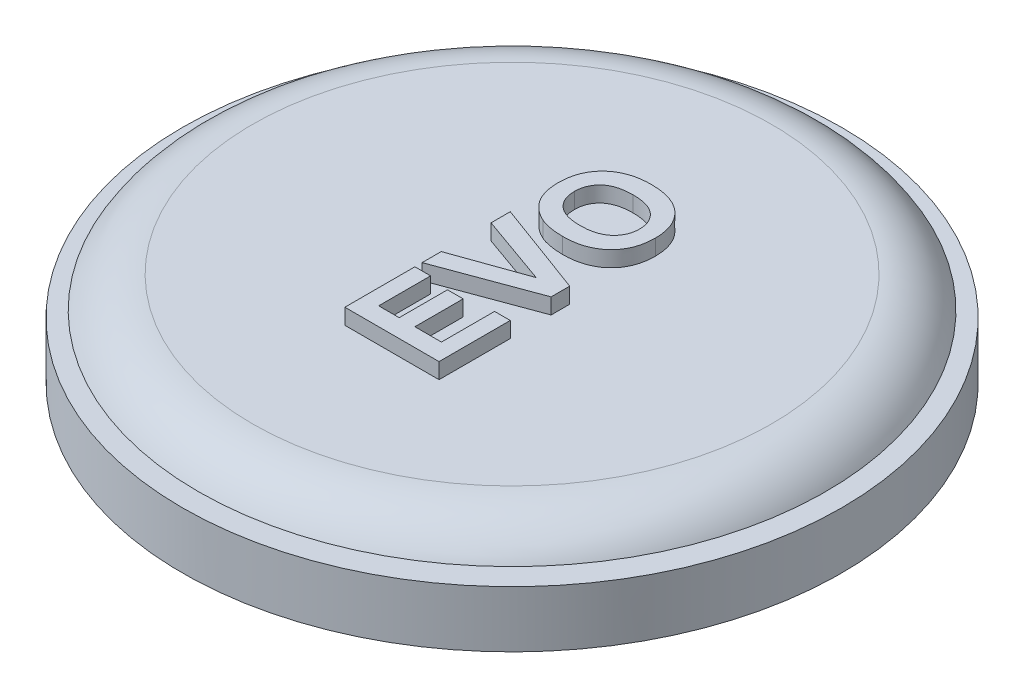
from build123d import *

# Parameters (mm, degrees)
SKETCH1_R           = 17.3
BOSS_EXTRUDE1_DEPTH = 4
SKETCH2_R           = 20
BOSS_EXTRUDE2_DEPTH = 2
CHAMFER1_SIZE       = 0.5
CHAMFER1_SIZE2      = 1.37373871
BOSS_EXTRUDE3_DEPTH = 1
SKETCH4_R           = 21
SKETCH4_R_2         = 17.8
BOSS_EXTRUDE4_DEPTH = 3.6
FILLET1_R           = 4


with BuildPart() as part:
    # Sketch1 → Boss-Extrude1 (new body)
    with BuildSketch(Plane(origin=(0, 0, 0), x_dir=(1, 0, 0), z_dir=(0, 1, 0))):
        with Locations(Location((0, 0, 0), (0, 0, 270))):
            Circle(SKETCH1_R)
    extrude(amount=BOSS_EXTRUDE1_DEPTH)

    # Sketch2 → Boss-Extrude2 (add)
    with BuildSketch(Plane(origin=(0, 4, 0), x_dir=(1, 0, 0), z_dir=(0, 1, 0))):
        with Locations(Location((0, 0, 0), (0, 0, 270))):
            Circle(SKETCH2_R)
    extrude(amount=BOSS_EXTRUDE2_DEPTH)

    # Chamfer1
    chamfer1_edges = [part.edges().sort_by_distance(p)[0] for p in [
        (0, 0, -17.3),
    ]]
    chamfer1_side = [part.faces().sort_by_distance(p)[0] for p in [
        (0, 0, 0),
    ]]
    chamfer(chamfer1_edges, length=CHAMFER1_SIZE, length2=CHAMFER1_SIZE2, reference=chamfer1_side[0])

    # Sketch3 → Boss-Extrude3 (add)
    # profile 1 of 3: a face of its own
    with BuildSketch(Plane(origin=(0, 6, 0), x_dir=(1, 0, 0), z_dir=(0, 1, 0))):
        Polygon((3.5, -8.153846154), (-2.5, -8.153846154), (-2.5, -3.692307692), (-1.5, -3.692307692), (-1.5, -7), (-0.192307692, -7), (-0.192307692, -3.923076923), (0.807692308, -3.923076923), (0.807692308, -7), (2.5, -7), (2.5, -3.615384615), (3.5, -3.615384615), align=None)
    # profile 2 of 3: a face of its own
    with BuildSketch(Plane(origin=(0, 6, 0), x_dir=(1, 0, 0), z_dir=(0, 1, 0))):
        Polygon((3.5, -1.012019231), (-2.5, -3.230769231), (-2.5, -2.012019231), (1.961538462, -0.423076923), (-2.5, 1.159855769), (-2.5, 2.384615385), (3.5, 0.174278846), align=None)
    # profile 3 of 3: a face of its own
    with BuildSketch(Plane(origin=(0, 6, 0), x_dir=(1, 0, 0), z_dir=(0, 1, 0))):
        with BuildLine():
            add(Edge.make_bspline(
                [(0.536057692, 2.692307692), (0.461912169, 2.692732288), (0.316299931, 2.693566139), (0.102681311, 2.708014837), (-0.102080111, 2.727059346), (-0.297178935, 2.7580733), (-0.48352829, 2.794557032), (-0.66107286, 2.840188498), (-0.829190002, 2.895158255), (-0.936530981, 2.938887132), (-0.989182692, 2.960336538)],
                knots=[0, 0, 0, 0, 1.141009212, 2.240794809, 3.294380675, 4.305229195, 5.280013876, 6.216333343, 7.125095522, 8, 8, 8, 8], degree=3))
            add(Edge.make_bspline(
                [(-0.989182692, 2.960336538), (-1.064045062, 2.995381495), (-1.212889297, 3.065059221), (-1.423284081, 3.194940159), (-1.622520045, 3.340957789), (-1.807985373, 3.503762135), (-1.976273284, 3.679250682), (-2.121442274, 3.8662452), (-2.246924651, 4.059835868), (-2.310075686, 4.197471854), (-2.341346154, 4.265625)],
                knots=[0, 0, 0, 0, 1.031298788, 2.050467816, 3.080965632, 4.112446372, 5.127889083, 6.11150152, 7.064873096, 8, 8, 8, 8], degree=3))
            add(Edge.make_bspline(
                [(-2.341346154, 4.265625), (-2.36032292, 4.311889746), (-2.398679804, 4.405402593), (-2.446551204, 4.550732565), (-2.485444553, 4.701576766), (-2.520210675, 4.856844152), (-2.54418306, 5.018042238), (-2.564283081, 5.183868476), (-2.574817852, 5.355230377), (-2.576213703, 5.47114174), (-2.576923077, 5.530048077)],
                knots=[0, 0, 0, 0, 0.92659354, 1.872881803, 2.832850937, 3.813025581, 4.820167273, 5.851730198, 6.908245912, 8, 8, 8, 8], degree=3))
            add(Edge.make_bspline(
                [(-2.576923077, 5.530048077), (-2.574279131, 5.635524435), (-2.569104893, 5.841943116), (-2.531731982, 6.143462843), (-2.468624386, 6.428792059), (-2.377410507, 6.69696489), (-2.263391215, 6.950293554), (-2.121963134, 7.186809415), (-1.954657548, 7.4068641), (-1.763766491, 7.61002662), (-1.54963122, 7.793006532), (-1.314219689, 7.95230111), (-1.058428096, 8.08634923), (-0.783133069, 8.195583929), (-0.488073589, 8.280950362), (-0.173547671, 8.341759709), (0.160999915, 8.378135477), (0.390531821, 8.382416673), (0.508413462, 8.384615385)],
                knots=[0, 0, 0, 0, 1.064649597, 2.083533894, 3.06182455, 4.009573214, 4.938114978, 5.86134754, 6.785138072, 7.723633163, 8.670337, 9.622734556, 10.587021061, 11.579917593, 12.607721694, 13.68331646, 14.81021135, 16, 16, 16, 16], degree=3))
            add(Edge.make_bspline(
                [(0.508413462, 8.384615385), (0.625502693, 8.382457893), (0.853453552, 8.378257659), (1.185418087, 8.341337664), (1.498255599, 8.282445298), (1.790928875, 8.196577649), (2.065135144, 8.088924118), (2.31824048, 7.954255311), (2.553777896, 7.798191605), (2.765616292, 7.615499739), (2.957600047, 7.415749174), (3.122950989, 7.195975576), (3.264570499, 6.961180913), (3.378919342, 6.709233585), (3.468254689, 6.441775319), (3.531847225, 6.157933395), (3.569076319, 5.857562209), (3.574269344, 5.651947799), (3.576923077, 5.546875)],
                knots=[0, 0, 0, 0, 1.188441339, 2.313673251, 3.386638619, 4.416397407, 5.405891428, 6.372077474, 7.321986495, 8.268353052, 9.206290124, 10.129648818, 11.054654577, 11.984788619, 12.932788448, 13.912688147, 14.933344701, 16, 16, 16, 16], degree=3))
            add(Edge.make_bspline(
                [(3.576923077, 5.546875), (3.574250081, 5.440606648), (3.56901826, 5.232608955), (3.532086394, 4.928968883), (3.467844147, 4.642664358), (3.380536597, 4.372254659), (3.265682212, 4.118902272), (3.126018439, 3.881878952), (2.959462483, 3.662813738), (2.769780203, 3.461379628), (2.558558225, 3.27879165), (2.324518577, 3.123001073), (2.073634225, 2.987947467), (1.802109992, 2.880585343), (1.512738113, 2.79442276), (1.20385391, 2.735695183), (0.876307406, 2.698636721), (0.651547296, 2.694455929), (0.536057692, 2.692307692)],
                knots=[0, 0, 0, 0, 1.080851458, 2.115536814, 3.105208919, 4.06142606, 5.000707585, 5.928846123, 6.853919921, 7.79375822, 8.738786042, 9.687076824, 10.64785939, 11.631623957, 12.651566366, 13.714523363, 14.825642194, 16, 16, 16, 16], degree=3))
        make_face()
        with BuildLine():
            add(Edge.make_bspline(
                [(0.496394231, 3.846153846), (0.579389989, 3.847306669), (0.740109696, 3.849539087), (0.973391986, 3.873312358), (1.191472619, 3.909400041), (1.394129342, 3.962438602), (1.581421488, 4.029554109), (1.753502267, 4.111253032), (1.909905592, 4.20892881), (2.049040642, 4.322529511), (2.172879925, 4.4466519), (2.282174308, 4.578623761), (2.372534629, 4.720877366), (2.447682974, 4.870085953), (2.50513219, 5.02757294), (2.548258299, 5.192351574), (2.571811156, 5.365902285), (2.575200825, 5.484309712), (2.576923077, 5.544471154)],
                knots=[0, 0, 0, 0, 1.313714757, 2.543983635, 3.708927593, 4.810629344, 5.856122632, 6.85490097, 7.821198974, 8.76835797, 9.692418868, 10.594039946, 11.475666139, 12.355144307, 13.23425633, 14.12512326, 15.047396847, 16, 16, 16, 16], degree=3))
            add(Edge.make_bspline(
                [(2.576923077, 5.544471154), (2.575236293, 5.604641115), (2.571916431, 5.723065308), (2.547872097, 5.896396901), (2.506620801, 6.061523779), (2.449345655, 6.21830978), (2.37340808, 6.365936861), (2.283346485, 6.50641813), (2.175254899, 6.637412989), (2.0529265, 6.760856514), (1.913005947, 6.871483063), (1.756584116, 6.96830124), (1.583471675, 7.049966229), (1.394252357, 7.117087633), (1.188592806, 7.168820628), (0.966466826, 7.203435724), (0.728485546, 7.227401244), (0.564166666, 7.22962456), (0.479567308, 7.230769231)],
                knots=[0, 0, 0, 0, 0.949303347, 1.86838219, 2.75460872, 3.63067551, 4.495816858, 5.369073575, 6.258675874, 7.17059545, 8.106564835, 9.066168793, 10.067192861, 11.120964654, 12.229518689, 13.408091079, 14.665559114, 16, 16, 16, 16], degree=3))
            add(Edge.make_bspline(
                [(0.479567308, 7.230769231), (0.395783975, 7.229478346), (0.233529589, 7.226978424), (-0.00143621, 7.205149769), (-0.220079654, 7.169527516), (-0.422514597, 7.119497213), (-0.608712267, 7.054862228), (-0.77836884, 6.975148016), (-0.932085204, 6.881490733), (-1.068558354, 6.772812379), (-1.18731946, 6.651813065), (-1.292414499, 6.522505793), (-1.379732754, 6.382400276), (-1.453273108, 6.233471369), (-1.507814258, 6.074064924), (-1.547601053, 5.905828868), (-1.572100606, 5.728279375), (-1.575291742, 5.6066494), (-1.576923077, 5.544471154)],
                knots=[0, 0, 0, 0, 1.332239421, 2.580008232, 3.749024652, 4.852419255, 5.89224124, 6.878439556, 7.828083302, 8.748549668, 9.645153656, 10.519845698, 11.393144178, 12.26513999, 13.155815239, 14.066102797, 15.011375811, 16, 16, 16, 16], degree=3))
            add(Edge.make_bspline(
                [(-1.576923077, 5.544471154), (-1.575316276, 5.482285395), (-1.572173131, 5.360640724), (-1.547275797, 5.182809612), (-1.508646128, 5.014061126), (-1.451092454, 4.854614019), (-1.37797532, 4.704814324), (-1.289278248, 4.563496917), (-1.184152388, 4.431962749), (-1.062491387, 4.310564904), (-0.924951921, 4.200214761), (-0.769728259, 4.105041523), (-0.598166899, 4.024868471), (-0.410754627, 3.958185569), (-0.20667787, 3.909097891), (0.012838891, 3.871293652), (0.249181199, 3.850082068), (0.412218797, 3.847491396), (0.496394231, 3.846153846)],
                knots=[0, 0, 0, 0, 0.981853791, 1.920653289, 2.83086505, 3.71158433, 4.591757822, 5.459075689, 6.341611823, 7.24548826, 8.168543921, 9.120390574, 10.113981418, 11.154755163, 12.256733604, 13.425033512, 14.670558662, 16, 16, 16, 16], degree=3))
        make_face(mode=Mode.SUBTRACT)
    extrude(amount=BOSS_EXTRUDE3_DEPTH)

    # Fillet1
    # the kernel refuses this fillet: 4 mm, written as the material it takes off along each edge
    with BuildSketch(Plane(origin=(0, 6, 0), x_dir=(0, 0, 1), z_dir=(-1, 0, 0))) as fillet1_piece_1:
        with BuildLine():
            CenterArc((16.535898385, -4), FILLET1_R, 30, 60)
            Line((16.535898385, 0), (16.535898385, 0.08))
            Line((16.535898385, 0.08), (20, 0.08))
            Line((20, 0.08), (20.08, 0))
            ThreePointArc((20.08, 0), (20.08, -1), (20.069282032, -1.96))
            Line((20.069282032, -1.96), (20, -2))
        make_face()
    revolve(axis=Axis((0, 6, 0), (0, 1, 0)), mode=Mode.SUBTRACT)


with BuildPart() as body_2:
    # Sketch4 → Boss-Extrude4 (new body)
    with BuildSketch(Plane.XZ):
        with Locations(Location((0, 0, 0), (0, 0, 270))):
            Circle(SKETCH4_R)
        with Locations(Location((0, 0, 0), (0, 0, 270))):
            Circle(SKETCH4_R_2, mode=Mode.SUBTRACT)
    extrude(amount=-BOSS_EXTRUDE4_DEPTH)


solid = Compound([part.part, body_2.part])
